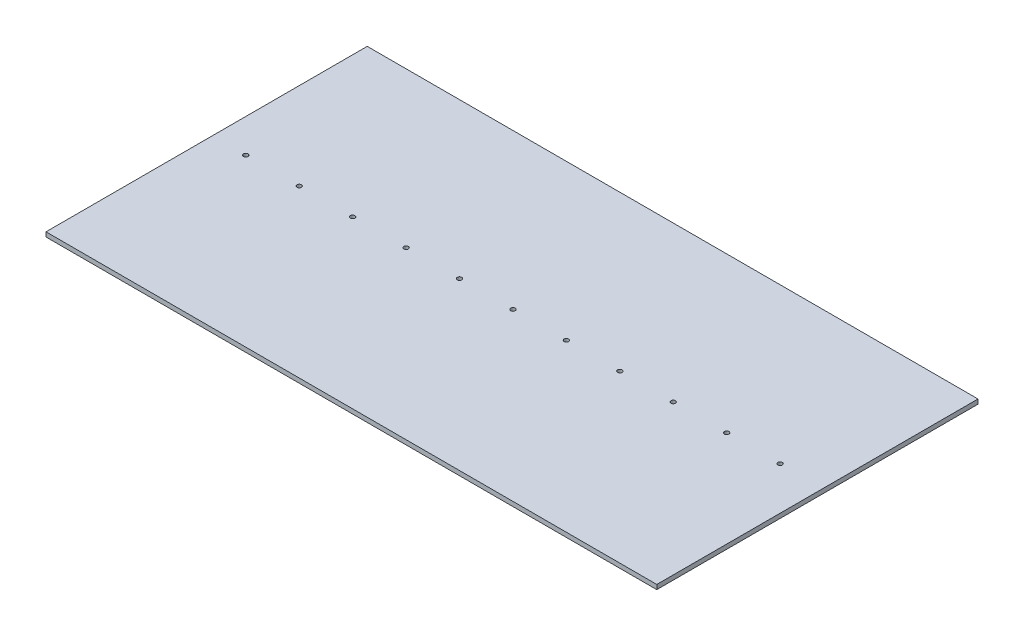
from build123d import *

# Parameters (mm, degrees)
SKETCH1_W               = 857.25
SKETCH1_H               = 450.85
BOSS_EXTRUDE1_DEPTH     = 6.35
CUT_EXTRUDE1_DEPTH      = 969.598785618
CUT_EXTRUDE1_DEPTH_BACK = 969.598785618
SKETCH2_R               = 3.175


with BuildPart() as part:
    # Sketch1 → Boss-Extrude1 (new body)
    with BuildSketch(Plane(origin=(0, 0, 0), x_dir=(1, 0, 0), z_dir=(0, 1, 0))):
        with Locations((428.625, 225.425)):
            Rectangle(SKETCH1_W, SKETCH1_H)
    extrude(amount=BOSS_EXTRUDE1_DEPTH)

    # Sketch2 → Cut-Extrude1 (cut, two sides: drawn at the far end of the back side and taken through both)
    with BuildSketch(Plane(origin=(0, 6.35, 0), x_dir=(1, 0, 0), z_dir=(0, 1, 0)).offset(-CUT_EXTRUDE1_DEPTH_BACK)):
        with Locations((47.052, 233.342129526)):
            Circle(SKETCH2_R)
        with Locations((647.052, 233.342129526)):
            Circle(SKETCH2_R)
        with Locations((122.052, 233.342129526)):
            Circle(SKETCH2_R)
        with Locations((197.052, 233.342129526)):
            Circle(SKETCH2_R)
        with Locations((272.052, 233.342129526)):
            Circle(SKETCH2_R)
        with Locations((347.052, 233.342129526)):
            Circle(SKETCH2_R)
        with Locations((422.052, 233.342129526)):
            Circle(SKETCH2_R)
        with Locations((497.052, 233.342129526)):
            Circle(SKETCH2_R)
        with Locations((572.052, 233.342129526)):
            Circle(SKETCH2_R)
        with Locations((722.052, 233.342129526)):
            Circle(SKETCH2_R)
        with Locations((797.052, 233.342129526)):
            Circle(SKETCH2_R)
    extrude(amount=CUT_EXTRUDE1_DEPTH + CUT_EXTRUDE1_DEPTH_BACK, mode=Mode.SUBTRACT)


solid = part.part
